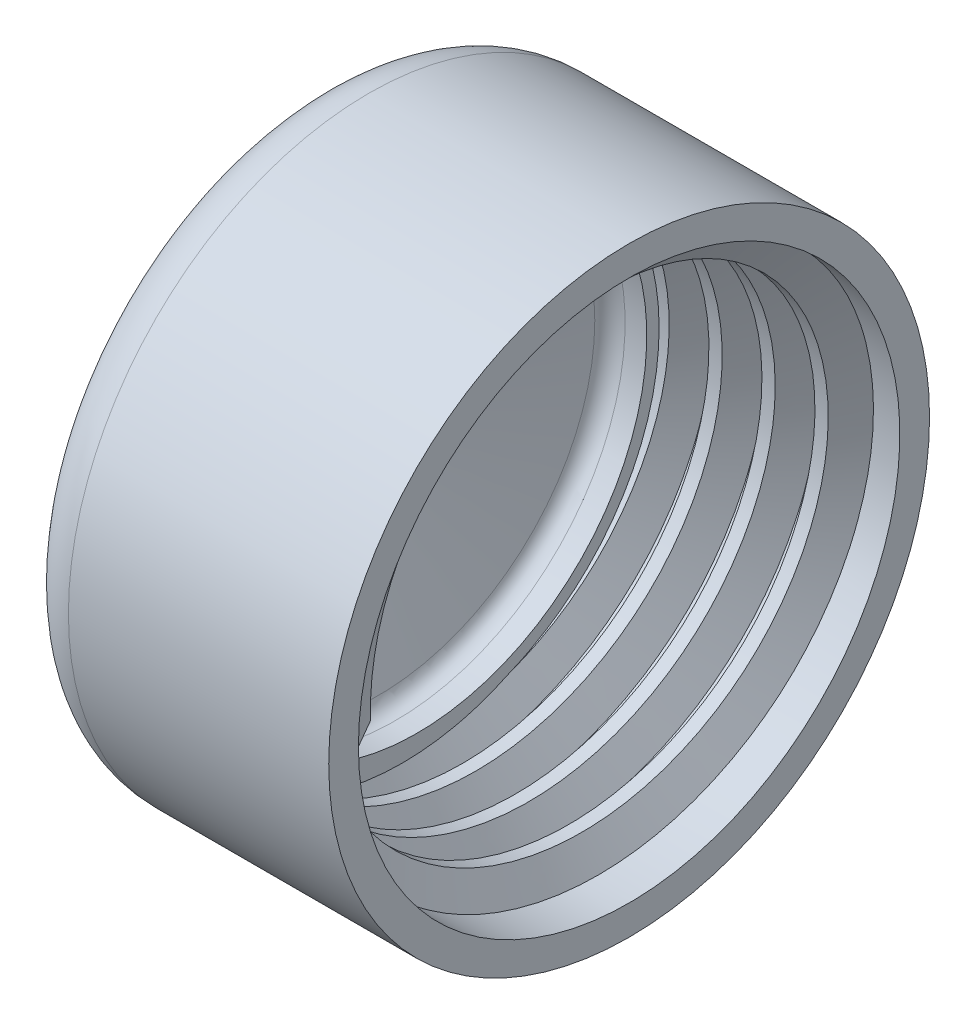
from build123d import *

# Parameters (mm, degrees)
THREAD1_PITCH = 3


with BuildPart() as part:
    # Sketch1 → Revolve1 (revolve)
    with BuildSketch(Plane(origin=(0, 0, 0), x_dir=(1, 0, 0), z_dir=(0, 1, 0)), mode=Mode.PRIVATE) as revolve1_sk:
        with BuildLine():
            Line((12.26847395, 17), (12.26847395, 15.32))
            Line((12.26847395, 15.32), (0.26847395, 15.32))
            Line((0.26847395, 15.32), (0.26847395, 13))
            Line((0.26847395, 13), (-0.958929152, 13))
            ThreePointArc((-0.958929152, 13), (-1.570312053, 12.791334916), (-1.926546425, 12.252421897))
            Line((-1.926546425, 12.252421897), (-4.73152605, 1.5))
            Line((-4.73152605, 1.5), (-6.73152605, 1.5))
            Line((-6.73152605, 1.5), (-6.73152605, 2.69876437))
            Line((-6.73152605, 2.69876437), (-5.462283171, 2.69876437))
            Line((-5.462283171, 2.69876437), (-5.462283171, 14))
            ThreePointArc((-5.462283171, 14), (-4.583603515, 16.121320344), (-2.462283171, 17))
            Line((-2.462283171, 17), (0.26847395, 17))
            Line((0.26847395, 17), (12.26847395, 17))
        make_face()
    revolve(revolve1_sk.sketch.rotate(Axis((-10, 0, 0), (1, 0, 0)), 180), axis=Axis((-10, 0, 0), (1, 0, 0)))

    # Thread1: the profile of Thread Profile2 profile screwed along a right-hand helix of 4 turns, 10 arcs to a turn; built about Z, then put on its axis
    thread1_z = Axis((0, 0, 0), (0, 0, 1))
    thread1_corners = [(15.3203, 0, -0.000173205), (15.3203, 0, 2.625173197), (13.696202375, 0, 1.687499996), (13.696202375, 0, 0.937499996)]
    with BuildLine(mode=Mode.PRIVATE) as thread1_profile:
        Line(thread1_corners[0], thread1_corners[1])
        Line(thread1_corners[1], thread1_corners[2])
        Line(thread1_corners[2], thread1_corners[3])
        Line(thread1_corners[3], thread1_corners[0])
    thread1_cap = Face(thread1_profile.wire())
    thread1_turn_angles = [0, 18, 36, 54, 72, 90, 108, 126, 144, 162, 180, 198, 216, 234, 252, 270, 288, 306, 324, 342, 360]
    thread1_turn_weights = [1, 0.9510565162951535, 1, 0.9510565162951535, 1, 0.9510565162951535, 1, 0.9510565162951535, 1, 0.9510565162951535, 1, 0.9510565162951535, 1, 0.9510565162951535, 1, 0.9510565162951535, 1, 0.9510565162951535, 1, 0.9510565162951535, 1]
    thread1_turn_rails = [Edge.make_bspline([Vector(p[0], p[1], 0).rotate(thread1_z, thread1_turn_angles[k]) / thread1_turn_weights[k] + Vector(0, 0, p[2] + THREAD1_PITCH * thread1_turn_angles[k] / 360) for k in range(21)], [0, 0, 0, 1, 1, 2, 2, 3, 3, 4, 4, 5, 5, 6, 6, 7, 7, 8, 8, 9, 9, 10, 10, 10], 2, thread1_turn_weights) for p in thread1_corners]
    thread1_turn_sides = [Face.make_surface_from_curves(thread1_turn_rails[p[0]], thread1_turn_rails[p[1]]) for p in [(0, 1), (1, 2), (2, 3), (3, 0)]]
    thread1 = Plane(origin=(12.26847395, 0, 0), x_dir=(0, 0, 1), z_dir=(-1, 0, 0)) * Solid(Shell([*[p.moved(Location((0, 0, THREAD1_PITCH * i))) for i in range(4) for p in thread1_turn_sides], thread1_cap, thread1_cap.rotate(thread1_z, 1440).moved(Location((0, 0, THREAD1_PITCH * 1440 / 360)))]))
    add(thread1)


solid = part.part
